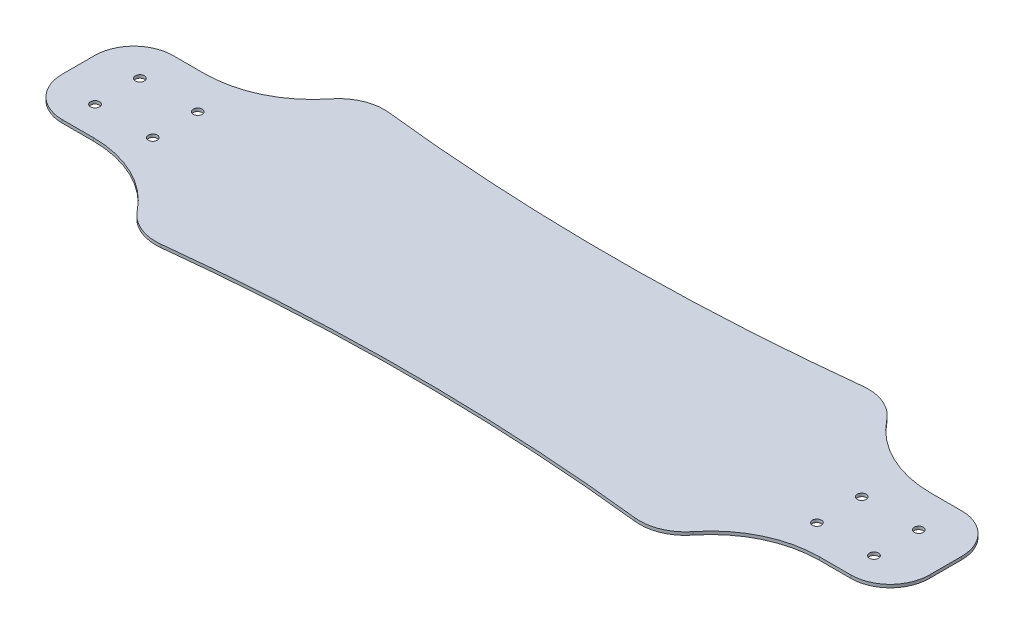
from build123d import *

# Parameters (mm, degrees)
BOSS_EXTRUDE1_DEPTH = 3.175
SKETCH3_R           = 4.693761022
CUT_EXTRUDE3_DEPTH  = 475.048496063


with BuildPart() as part:
    # Sketch2 → Boss-Extrude1 (new body)
    with BuildSketch(Plane(origin=(0, 0, 0), x_dir=(1, 0, 0), z_dir=(0, 1, 0))):
        with BuildLine():
            Line((377.586585294, 85.311447403), (410.015686702, 85.311447403))
            ThreePointArc((410.015686702, 85.311447403), (439.024508929, 73.216857724), (450.85, 44.09730025))
            Line((450.85, 44.09730025), (450.85, 11.194701584))
            ThreePointArc((450.85, 11.194701584), (439.024508929, -17.924855889), (410.015686702, -30.019445568))
            Line((410.015686702, -30.019445568), (377.586585294, -30.019445568))
            ThreePointArc((377.586585294, -30.019445568), (328.322873464, -41.348377811), (288.956771311, -73.059070177))
            ThreePointArc((288.956771311, -73.059070177), (270.009061448, -87.471787235), (246.444284524, -90.854598277))
            ThreePointArc((246.444284524, -90.854598277), (123.413104499, -80.563055711), (0, -77.128999083))
            ThreePointArc((0, -77.128999083), (-123.413104499, -80.563055711), (-246.444284524, -90.854598277))
            ThreePointArc((-246.444284524, -90.854598277), (-270.009061448, -87.471787235), (-288.956771311, -73.059070177))
            ThreePointArc((-288.956771311, -73.059070177), (-328.322873464, -41.348377811), (-377.586585294, -30.019445568))
            Line((-377.586585294, -30.019445568), (-410.015686702, -30.019445568))
            ThreePointArc((-410.015686702, -30.019445568), (-439.024508929, -17.924855889), (-450.85, 11.194701584))
            Line((-450.85, 11.194701584), (-450.85, 44.09730025))
            ThreePointArc((-450.85, 44.09730025), (-439.024508929, 73.216857724), (-410.015686702, 85.311447403))
            Line((-410.015686702, 85.311447403), (-377.586585294, 85.311447403))
            ThreePointArc((-377.586585294, 85.311447403), (-328.322873464, 96.640379646), (-288.956771311, 128.351072012))
            ThreePointArc((-288.956771311, 128.351072012), (-270.009061448, 142.763789069), (-246.444284524, 146.146600112))
            ThreePointArc((-246.444284524, 146.146600112), (-123.413104499, 135.855057545), (0, 132.421000917))
            ThreePointArc((0, 132.421000917), (123.413104499, 135.855057545), (246.444284524, 146.146600112))
            ThreePointArc((246.444284524, 146.146600112), (270.009061448, 142.763789069), (288.956771311, 128.351072012))
            ThreePointArc((288.956771311, 128.351072012), (328.322873464, 96.640379646), (377.586585294, 85.311447403))
        make_face()
    extrude(amount=BOSS_EXTRUDE1_DEPTH)

    # Sketch3 → Cut-Extrude3 (cut, through all)
    with BuildSketch(Plane(origin=(0, 0, 0), x_dir=(1, 0, 0), z_dir=(0, 1, 0))):
        with Locations((-406.739849856, 0.85097787)):
            Circle(SKETCH3_R)
        with Locations((-406.739849856, 47.508250984)):
            Circle(SKETCH3_R)
        with Locations((-346.652535715, 0.85097787)):
            Circle(SKETCH3_R)
        with Locations((-346.652535715, 47.508250984)):
            Circle(SKETCH3_R)
        with Locations((345.330168847, -0.654343758)):
            Circle(SKETCH3_R)
        with Locations((345.330168847, 46.010495362)):
            Circle(SKETCH3_R)
        with Locations((404.656010829, -0.654343758)):
            Circle(SKETCH3_R)
        with Locations((404.656010829, 46.010495362)):
            Circle(SKETCH3_R)
    extrude(amount=CUT_EXTRUDE3_DEPTH, mode=Mode.SUBTRACT)


solid = part.part
